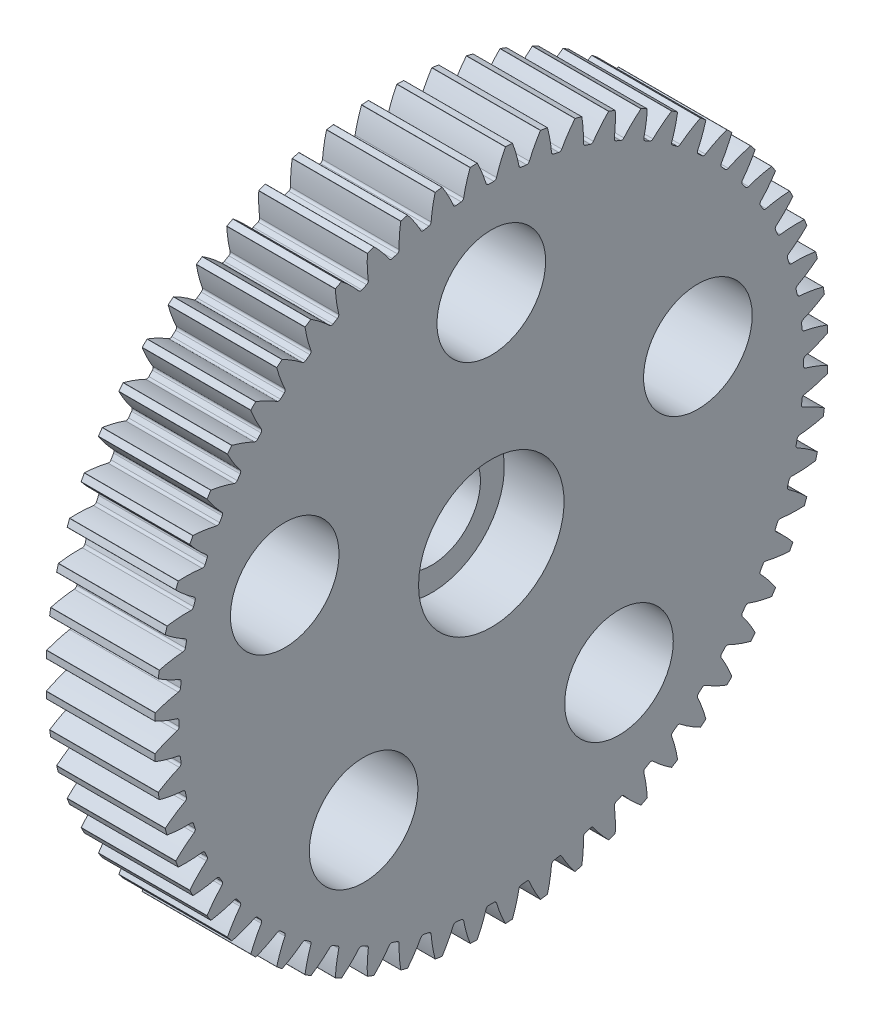
from build123d import *

# Parameters (mm, degrees)
BASPROSKE_W                = 10
BASPROSKE_H                = 31
TOOTHCUT_DEPTH             = 45.966654312
BREAKS_R                   = 0.02
ROOTFILLETS_R              = 0.251
TEETHCUTS_COUNT            = 60
TEETHCUTS_ANGLE            = 354
BREAKS_OF_TEETHCUTS_R      = 0.02
ROOTFILLETS_OF_TEETHCUTS_R = 0.251
BORSKE_R                   = 6.7
BORE_DEPTH                 = 50
SKETCH_2_R                 = 5
CUT_EXTRUDE_2_DEPTH        = 10
EXTRUDE_START              = -4.5
SKETCH_4_R                 = 6.7
SKETCH_4_R_2               = 4.5
EXTRUDE_1_DEPTH            = 4.5


with BuildPart() as part:
    # BasProSke → Base-Revolve (revolve)
    with BuildSketch(Plane(origin=(0, 0, 0), x_dir=(1, 0, 0), z_dir=(0, 1, 0))):
        with Locations((5, 15.5)):
            Rectangle(BASPROSKE_W, BASPROSKE_H)
    revolve(axis=Axis((-10, 0, 0), (1, 0, 0)))

    # TooCutSke → ToothCut (cut, through all)
    with BuildSketch(Plane(origin=(0, 0, 0), x_dir=(0, 0, -1), z_dir=(1, 0, 0))):
        with BuildLine():
            ThreePointArc((0.4299934, 28.745784155), (0, 28.749), (-0.4299934, 28.745784155))
            ThreePointArc((-0.4299934, 28.745784155), (-0.814372041, 29.894046209), (-1.312514358, 30.997725018))
            ThreePointArc((-1.312514358, 30.997725018), (0, 31.0255), (1.312514358, 30.997725018))
            ThreePointArc((1.312514358, 30.997725018), (0.814372041, 29.894046209), (0.4299934, 28.745784155))
        make_face()
    toothcut = extrude(amount=TOOTHCUT_DEPTH, mode=Mode.SUBTRACT)

    # Breaks
    breaks_edges = [part.edges().sort_by_distance(p)[0] for p in [
        (5, 30.972741674, -1.299720431),
        (5, 30.972741674, 1.299720431),
    ]]
    fillet(breaks_edges, radius=BREAKS_R)

    # RootFillets
    rootfillets_edges = [part.edges().sort_by_distance(p)[0] for p in [
        (5, 28.745784155, -0.4299934),
        (5, 28.745784155, 0.4299934),
    ]]
    fillet(rootfillets_edges, radius=ROOTFILLETS_R)

    # TeethCuts: ToothCut ×60 about axis
    teethcuts_axis = Axis((-10, 0, 0), (1, 0, 0))
    for i in range(1, TEETHCUTS_COUNT):
        add(toothcut.rotate(teethcuts_axis, i * TEETHCUTS_ANGLE / (TEETHCUTS_COUNT - 1)), mode=Mode.SUBTRACT)

    # Breaks of TeethCuts
    breaks_of_teethcuts_edges = [part.edges().sort_by_distance(p)[0] for p in [
        (5, 30.938927534, 1.944932663),
        (5, 30.667211975, 4.530133517),
        (5, 30.566140029, 5.168276669),
        (5, 30.025685884, 7.710913512),
        (5, 29.858463498, 8.334995954),
        (5, 29.055192095, 10.807211125),
        (5, 28.823651392, 11.410395279),
        (5, 27.766363542, 13.785102672),
        (5, 27.47304133, 14.360779926),
        (5, 26.173320899, 16.611961748),
        (5, 25.821430878, 17.153824862),
        (5, 24.293517875, 19.256816696),
        (5, 23.886915426, 19.758928904),
        (5, 22.147549985, 21.69068993),
        (5, 21.69068993, 22.147549985),
        (5, 19.758928904, 23.886915426),
        (5, 19.256816696, 24.293517875),
        (5, 17.153824862, 25.821430878),
        (5, 16.611961748, 26.173320899),
        (5, 14.360779926, 27.47304133),
        (5, 13.785102672, 27.766363542),
        (5, 11.410395279, 28.823651392),
        (5, 10.807211125, 29.055192095),
        (5, 8.334995954, 29.858463498),
        (5, 7.710913512, 30.025685884),
        (5, 5.168276669, 30.566140029),
        (5, 4.530133517, 30.667211975),
        (5, 1.944932663, 30.938927534),
        (5, 1.299720431, 30.972741674),
        (5, -1.299720431, 30.972741674),
        (5, -1.944932663, 30.938927534),
        (5, -4.530133517, 30.667211975),
        (5, -5.168276669, 30.566140029),
        (5, -7.710913512, 30.025685884),
        (5, -8.334995954, 29.858463498),
        (5, -10.807211125, 29.055192095),
        (5, -11.410395279, 28.823651392),
        (5, -13.785102672, 27.766363542),
        (5, -14.360779926, 27.47304133),
        (5, -16.611961748, 26.173320899),
        (5, -17.153824862, 25.821430878),
        (5, -19.256816696, 24.293517875),
        (5, -19.758928904, 23.886915426),
        (5, -21.69068993, 22.147549985),
        (5, -22.147549985, 21.69068993),
        (5, -23.886915426, 19.758928904),
        (5, -24.293517875, 19.256816696),
        (5, -25.821430878, 17.153824862),
        (5, -26.173320899, 16.611961748),
        (5, -27.47304133, 14.360779926),
        (5, -27.766363542, 13.785102672),
        (5, -28.823651392, 11.410395279),
        (5, -29.055192095, 10.807211125),
        (5, -29.858463498, 8.334995954),
        (5, -30.025685884, 7.710913512),
        (5, -30.566140029, 5.168276669),
        (5, -30.667211975, 4.530133517),
        (5, -30.938927534, 1.944932663),
        (5, -30.972741674, 1.299720431),
        (5, -30.972741674, -1.299720431),
        (5, -30.938927534, -1.944932663),
        (5, -30.667211975, -4.530133517),
        (5, -30.566140029, -5.168276669),
        (5, -30.025685884, -7.710913512),
        (5, -29.858463498, -8.334995954),
        (5, -29.055192095, -10.807211125),
        (5, -28.823651392, -11.410395279),
        (5, -27.766363542, -13.785102672),
        (5, -27.47304133, -14.360779926),
        (5, -26.173320899, -16.611961748),
        (5, -25.821430878, -17.153824862),
        (5, -24.293517875, -19.256816696),
        (5, -23.886915426, -19.758928904),
        (5, -22.147549985, -21.69068993),
        (5, -21.69068993, -22.147549985),
        (5, -19.758928904, -23.886915426),
        (5, -19.256816696, -24.293517875),
        (5, -17.153824862, -25.821430878),
        (5, -16.611961748, -26.173320899),
        (5, -14.360779926, -27.47304133),
        (5, -13.785102672, -27.766363542),
        (5, -11.410395279, -28.823651392),
        (5, -10.807211125, -29.055192095),
        (5, -8.334995954, -29.858463498),
        (5, -7.710913512, -30.025685884),
        (5, -5.168276669, -30.566140029),
        (5, -4.530133517, -30.667211975),
        (5, -1.944932663, -30.938927534),
        (5, -1.299720431, -30.972741674),
        (5, 1.299720431, -30.972741674),
        (5, 1.944932663, -30.938927534),
        (5, 4.530133517, -30.667211975),
        (5, 5.168276669, -30.566140029),
        (5, 7.710913512, -30.025685884),
        (5, 8.334995954, -29.858463498),
        (5, 10.807211125, -29.055192095),
        (5, 11.410395279, -28.823651392),
        (5, 13.785102672, -27.766363542),
        (5, 14.360779926, -27.47304133),
        (5, 16.611961748, -26.173320899),
        (5, 17.153824862, -25.821430878),
        (5, 19.256816696, -24.293517875),
        (5, 19.758928904, -23.886915426),
        (5, 21.69068993, -22.147549985),
        (5, 22.147549985, -21.69068993),
        (5, 23.886915426, -19.758928904),
        (5, 24.293517875, -19.256816696),
        (5, 25.821430878, -17.153824862),
        (5, 26.173320899, -16.611961748),
        (5, 27.47304133, -14.360779926),
        (5, 27.766363542, -13.785102672),
        (5, 28.823651392, -11.410395279),
        (5, 29.055192095, -10.807211125),
        (5, 29.858463498, -8.334995954),
        (5, 30.025685884, -7.710913512),
        (5, 30.566140029, -5.168276669),
        (5, 30.667211975, -4.530133517),
        (5, 30.938927534, -1.944932663),
    ]]
    fillet(breaks_of_teethcuts_edges, radius=BREAKS_OF_TEETHCUTS_R)

    # RootFillets of TeethCuts
    rootfillets_of_teethcuts_edges = [part.edges().sort_by_distance(p)[0] for p in [
        (5, 28.633258291, 2.577114792),
        (5, 28.543365192, 3.432390494),
        (5, 28.207020457, 5.555987575),
        (5, 28.028219147, 6.3971816),
        (5, 27.471740605, 8.473987796),
        (5, 27.205990068, 9.291883845),
        (5, 26.435474613, 11.299145232),
        (5, 26.085686469, 12.084782267),
        (5, 25.10957603, 14.00050687),
        (5, 24.67958263, 14.745277285),
        (5, 23.508571677, 16.548476024),
        (5, 23.003084119, 17.24421996),
        (5, 21.650002493, 18.915136612),
        (5, 21.074559005, 19.554231352),
        (5, 19.554231352, 21.074559005),
        (5, 18.915136612, 21.650002493),
        (5, 17.24421996, 23.003084119),
        (5, 16.548476024, 23.508571677),
        (5, 14.745277285, 24.67958263),
        (5, 14.00050687, 25.10957603),
        (5, 12.084782267, 26.085686469),
        (5, 11.299145232, 26.435474613),
        (5, 9.291883845, 27.205990068),
        (5, 8.473987796, 27.471740605),
        (5, 6.3971816, 28.028219147),
        (5, 5.555987575, 28.207020457),
        (5, 3.432390494, 28.543365192),
        (5, 2.577114792, 28.633258291),
        (5, 0.4299934, 28.745784155),
        (5, -0.4299934, 28.745784155),
        (5, -2.577114792, 28.633258291),
        (5, -3.432390494, 28.543365192),
        (5, -5.555987575, 28.207020457),
        (5, -6.3971816, 28.028219147),
        (5, -8.473987796, 27.471740605),
        (5, -9.291883845, 27.205990068),
        (5, -11.299145232, 26.435474613),
        (5, -12.084782267, 26.085686469),
        (5, -14.00050687, 25.10957603),
        (5, -14.745277285, 24.67958263),
        (5, -16.548476024, 23.508571677),
        (5, -17.24421996, 23.003084119),
        (5, -18.915136612, 21.650002493),
        (5, -19.554231352, 21.074559005),
        (5, -21.074559005, 19.554231352),
        (5, -21.650002493, 18.915136612),
        (5, -23.003084119, 17.24421996),
        (5, -23.508571677, 16.548476024),
        (5, -24.67958263, 14.745277285),
        (5, -25.10957603, 14.00050687),
        (5, -26.085686469, 12.084782267),
        (5, -26.435474613, 11.299145232),
        (5, -27.205990068, 9.291883845),
        (5, -27.471740605, 8.473987796),
        (5, -28.028219147, 6.3971816),
        (5, -28.207020457, 5.555987575),
        (5, -28.543365192, 3.432390494),
        (5, -28.633258291, 2.577114792),
        (5, -28.745784155, 0.4299934),
        (5, -28.745784155, -0.4299934),
        (5, -28.633258291, -2.577114792),
        (5, -28.543365192, -3.432390494),
        (5, -28.207020457, -5.555987575),
        (5, -28.028219147, -6.3971816),
        (5, -27.471740605, -8.473987796),
        (5, -27.205990068, -9.291883845),
        (5, -26.435474613, -11.299145232),
        (5, -26.085686469, -12.084782267),
        (5, -25.10957603, -14.00050687),
        (5, -24.67958263, -14.745277285),
        (5, -23.508571677, -16.548476024),
        (5, -23.003084119, -17.24421996),
        (5, -21.650002493, -18.915136612),
        (5, -21.074559005, -19.554231352),
        (5, -19.554231352, -21.074559005),
        (5, -18.915136612, -21.650002493),
        (5, -17.24421996, -23.003084119),
        (5, -16.548476024, -23.508571677),
        (5, -14.745277285, -24.67958263),
        (5, -14.00050687, -25.10957603),
        (5, -12.084782267, -26.085686469),
        (5, -11.299145232, -26.435474613),
        (5, -9.291883845, -27.205990068),
        (5, -8.473987796, -27.471740605),
        (5, -6.3971816, -28.028219147),
        (5, -5.555987575, -28.207020457),
        (5, -3.432390494, -28.543365192),
        (5, -2.577114792, -28.633258291),
        (5, -0.4299934, -28.745784155),
        (5, 0.4299934, -28.745784155),
        (5, 2.577114792, -28.633258291),
        (5, 3.432390494, -28.543365192),
        (5, 5.555987575, -28.207020457),
        (5, 6.3971816, -28.028219147),
        (5, 8.473987796, -27.471740605),
        (5, 9.291883845, -27.205990068),
        (5, 11.299145232, -26.435474613),
        (5, 12.084782267, -26.085686469),
        (5, 14.00050687, -25.10957603),
        (5, 14.745277285, -24.67958263),
        (5, 16.548476024, -23.508571677),
        (5, 17.24421996, -23.003084119),
        (5, 18.915136612, -21.650002493),
        (5, 19.554231352, -21.074559005),
        (5, 21.074559005, -19.554231352),
        (5, 21.650002493, -18.915136612),
        (5, 23.003084119, -17.24421996),
        (5, 23.508571677, -16.548476024),
        (5, 24.67958263, -14.745277285),
        (5, 25.10957603, -14.00050687),
        (5, 26.085686469, -12.084782267),
        (5, 26.435474613, -11.299145232),
        (5, 27.205990068, -9.291883845),
        (5, 27.471740605, -8.473987796),
        (5, 28.028219147, -6.3971816),
        (5, 28.207020457, -5.555987575),
        (5, 28.543365192, -3.432390494),
        (5, 28.633258291, -2.577114792),
    ]]
    fillet(rootfillets_of_teethcuts_edges, radius=ROOTFILLETS_OF_TEETHCUTS_R)

    # BorSke → Bore (cut, symmetric)
    with BuildSketch(Plane(origin=(0, 0, 0), x_dir=(0, 0, -1), z_dir=(1, 0, 0))):
        Circle(BORSKE_R)
    extrude(amount=BORE_DEPTH, both=True, mode=Mode.SUBTRACT)

    # 草图2 → 切除-拉伸2 (cut)
    with BuildSketch(Plane(origin=(0, 0, 0), x_dir=(0, 0, -1), z_dir=(1, 0, 0))):
        with Locations((0, 20)):
            Circle(SKETCH_2_R)
        with Locations((19.021130326, 6.180339887)):
            Circle(SKETCH_2_R)
        with Locations((11.755705046, -16.180339887)):
            Circle(SKETCH_2_R)
        with Locations((-11.755705046, -16.180339887)):
            Circle(SKETCH_2_R)
        with Locations((-19.021130326, 6.180339887)):
            Circle(SKETCH_2_R)
    extrude(amount=CUT_EXTRUDE_2_DEPTH, mode=Mode.SUBTRACT)

    # 草图4 → 凸台-拉伸1 (add)
    with BuildSketch(Plane.ZY.offset(EXTRUDE_START)):
        Circle(SKETCH_4_R)
        Circle(SKETCH_4_R_2, mode=Mode.SUBTRACT)
    extrude(amount=EXTRUDE_1_DEPTH)


solid = part.part
